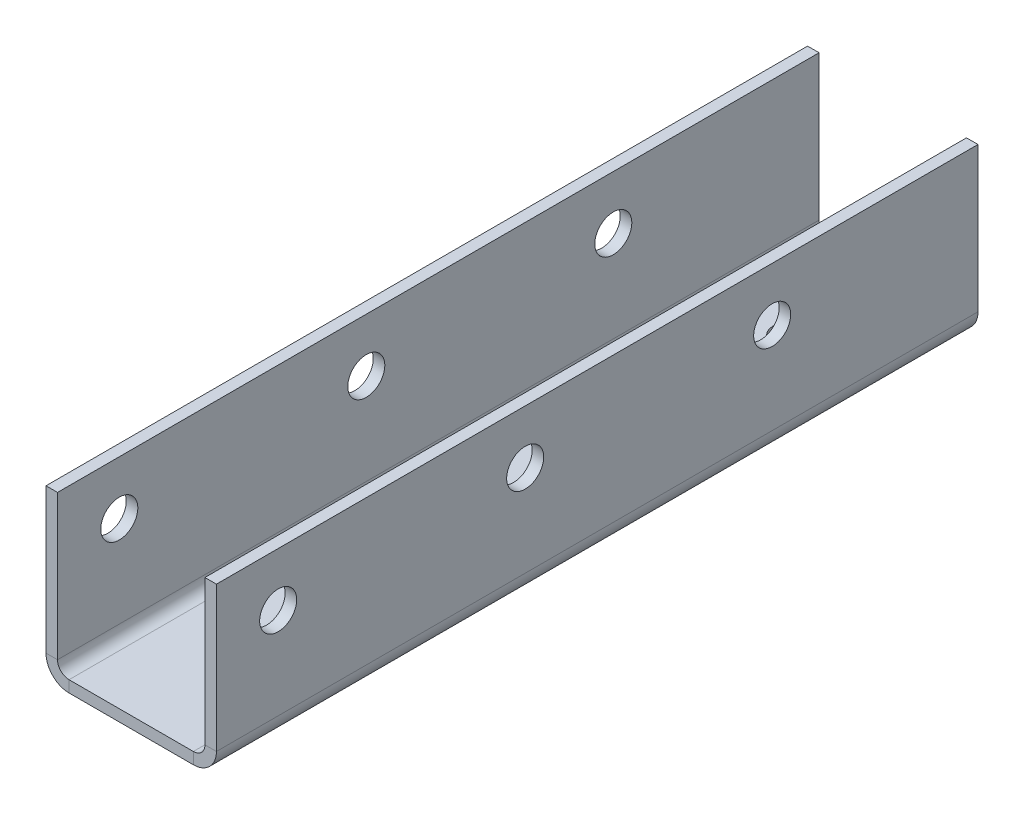
from build123d import *

# Parameters (mm, degrees)
BASE_FLANGE1_DEPTH = 185
CUT_EXTRUDE1_REACH = 192.573
SKETCH11_R         = 4
CUT_EXTRUDE2_REACH = 195.916
SKETCH13_R         = 4.5


# Sheet-metal steps are written as plain solids
with BuildPart() as part:
    # Sketch1 → Base-Flange1 (new body)
    with BuildSketch(Plane.XY):
        with BuildLine():
            Line((-20.7, 40.8), (-20.7, 5.6))
            ThreePointArc((-20.7, 5.6), (-19.059797975, 1.640202025), (-15.1, 0))
            Line((-15.1, 0), (15.1, 0))
            ThreePointArc((15.1, 0), (19.059797975, 1.640202025), (20.7, 5.6))
            Line((20.7, 5.6), (20.7, 40.8))
            Line((20.7, 40.8), (17.9, 40.8))
            Line((17.9, 40.8), (17.9, 5.6))
            ThreePointArc((17.9, 5.6), (17.079898987, 3.620101013), (15.1, 2.8))
            Line((15.1, 2.8), (-15.1, 2.8))
            ThreePointArc((-15.1, 2.8), (-17.079898987, 3.620101013), (-17.9, 5.6))
            Line((-17.9, 5.6), (-17.9, 40.8))
            Line((-17.9, 40.8), (-20.7, 40.8))
        make_face()
    extrude(amount=BASE_FLANGE1_DEPTH)

    # Sketch11 → Cut-Extrude1 (cut, up to next)
    with BuildSketch(Plane.XZ, mode=Mode.PRIVATE) as cut_extrude1_sk1:
        with Locations((0, 25)):
            Circle(SKETCH11_R)
    cut_extrude1_tool1 = extrude(cut_extrude1_sk1.sketch, amount=-CUT_EXTRUDE1_REACH, mode=Mode.PRIVATE) & part.part
    add(cut_extrude1_tool1.solids().sort_by_distance((0, 0, 25))[0], mode=Mode.SUBTRACT)

    # Cut-Extrude2: up to this face of the body (flat: up to its plane)
    cut_extrude2_end = Plane(part.part.faces().sort_by_distance((20.7, 23.2, 92.5))[0])
    # Sketch13 → Cut-Extrude2 (cut, up to the picked face)
    with BuildSketch(Plane.ZY.offset(20.7), mode=Mode.PRIVATE) as cut_extrude2_sk1:
        with Locations(Location((50, 27.8, 0), (0, 0, 180))):
            Circle(SKETCH13_R)
    cut_extrude2_tool1 = split(extrude(cut_extrude2_sk1.sketch, amount=-CUT_EXTRUDE2_REACH, mode=Mode.PRIVATE), bisect_by=cut_extrude2_end, keep=Keep.BOTH, mode=Mode.PRIVATE)
    # Sketch13 → Cut-Extrude2 (cut, up to the picked face)
    with BuildSketch(Plane.ZY.offset(20.7), mode=Mode.PRIVATE) as cut_extrude2_sk2:
        with Locations(Location((110, 27.8, 0), (0, 0, 180))):
            Circle(SKETCH13_R)
    cut_extrude2_tool2 = split(extrude(cut_extrude2_sk2.sketch, amount=-CUT_EXTRUDE2_REACH, mode=Mode.PRIVATE), bisect_by=cut_extrude2_end, keep=Keep.BOTH, mode=Mode.PRIVATE)
    # Sketch13 → Cut-Extrude2 (cut, up to the picked face)
    with BuildSketch(Plane.ZY.offset(20.7), mode=Mode.PRIVATE) as cut_extrude2_sk3:
        with Locations(Location((170, 27.8, 0), (0, 0, 180))):
            Circle(SKETCH13_R)
    cut_extrude2_tool3 = split(extrude(cut_extrude2_sk3.sketch, amount=-CUT_EXTRUDE2_REACH, mode=Mode.PRIVATE), bisect_by=cut_extrude2_end, keep=Keep.BOTH, mode=Mode.PRIVATE)
    add(cut_extrude2_tool1.solids().sort_by(Axis((-20.7, 27.8, 50), (1, 0, 0)))[0], mode=Mode.SUBTRACT)
    add(cut_extrude2_tool2.solids().sort_by(Axis((-20.7, 27.8, 110), (1, 0, 0)))[0], mode=Mode.SUBTRACT)
    add(cut_extrude2_tool3.solids().sort_by(Axis((-20.7, 27.8, 170), (1, 0, 0)))[0], mode=Mode.SUBTRACT)


solid = part.part
